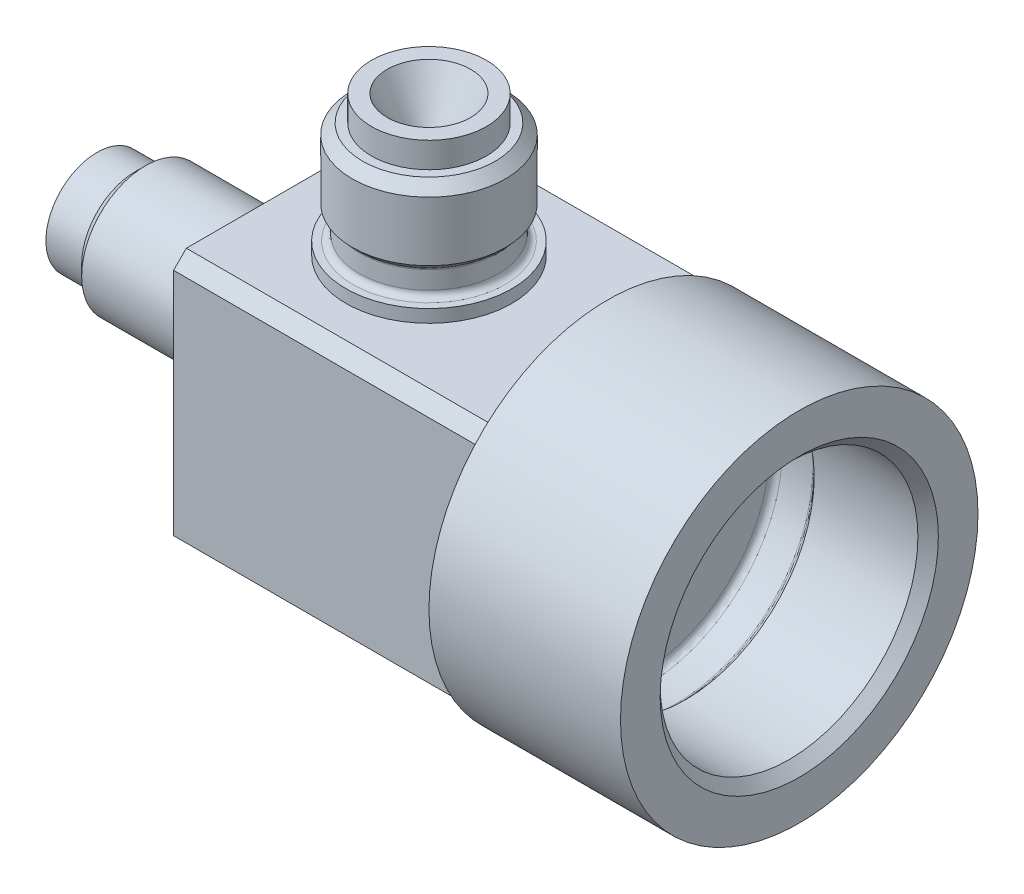
from build123d import *

# Parameters (mm, degrees)
EXTRUDE_2_DEPTH          = 48
CUT_EXTRUDE_1_REACH      = 131.819
CUT_EXTRUDE_1_END_RADIUS = 9
SKETCH_5_R               = 2.5
CHAMFER_1_SIZE           = 1.6
CHAMFER_2_SIZE           = 1.6
FILLET_1_R               = 1
FILLET_2_R               = 0.5
CHAMFER_3_SIZE           = 2
CHAMFER_4_SIZE           = 1.6


with BuildPart() as part:
    # Эскиз1 → Повернуть1 (revolve)
    with BuildSketch(Plane.XY, mode=Mode.PRIVATE) as revolve_1_sk:
        Polygon((0, 20.188), (0, 28), (-30, 28), (-30, 20), (-78, 20), (-78, 11), (-81, 11), (-81, 8.9), (-85, 8.9), (-86.1, 10), (-104, 10), (-104, 8), (-110, 8), (-110, 6.541451884), (-103, 2.5), (-63, 2.5), (-63, 5), (-66, 5), (-66, 9), (-49, 9), (-49, 12.5), (-25, 12.5), (-25, 21.35), (-19, 21.35), (-17.838, 20.188), align=None)
    revolve(revolve_1_sk.sketch.rotate(Axis((0, 0, 0), (-1, 0, 0)), 90), axis=Axis((0, 0, 0), (-1, 0, 0)))

    # Эскиз2 → Бобышка-Вытянуть2 (add)
    with BuildSketch(Plane.ZY.offset(78)):
        with BuildLine():
            ThreePointArc((9.9e-08, 20), (14.142135659, 14.142135589), (20, 0))
            Line((20, 0), (20, 20))
            Line((20, 20), (9.9e-08, 20))
        make_face()
        with BuildLine():
            Line((-20, 20), (-20, 9.9e-08))
            ThreePointArc((-20, 9.9e-08), (-14.142135554, 14.142135694), (9.9e-08, 20))
            Line((9.9e-08, 20), (-20, 20))
        make_face()
        with BuildLine():
            Line((-20, 9.9e-08), (-20, -20))
            Line((-20, -20), (-9.9e-08, -20))
            ThreePointArc((-9.9e-08, -20), (-14.142135694, -14.142135554), (-20, 9.9e-08))
        make_face()
        with BuildLine():
            ThreePointArc((20, 0), (14.142135589, -14.142135659), (-9.9e-08, -20))
            Line((-9.9e-08, -20), (20, -20))
            Line((20, -20), (20, 0))
        make_face()
    extrude(amount=-EXTRUDE_2_DEPTH)

    # Эскиз4 → Повернуть2 (revolve)
    with BuildSketch(Plane.XY, mode=Mode.PRIVATE) as revolve_2_sk:
        Polygon((-45, 20), (-45, 22), (-47.1, 22), (-47.1, 26), (-46, 27.1), (-46, 38), (-49, 38), (-49, 42), (-51.458548116, 42), (-55.5, 35), (-58, 35), (-58, 20), align=None)
    revolve(revolve_2_sk.sketch.rotate(Axis((-58, 0, 0), (0, 1, 0)), 90), axis=Axis((-58, 0, 0), (0, 1, 0)))

    # Вырез-Вытянуть1: up to this cylinder (the profile starts outside it)
    cut_extrude_1_end = Plane(origin=(-58, 0, 0), z_dir=(1, 0, 0)) * Cylinder(CUT_EXTRUDE_1_END_RADIUS, 282.638, mode=Mode.PRIVATE)
    # Эскиз5 → Вырез-Вытянуть1 (cut, up to the surface)
    with BuildSketch(Plane(origin=(0, 35, 0), x_dir=(1, 0, 0), z_dir=(0, 1, 0)), mode=Mode.PRIVATE) as cut_extrude_1_sk1:
        with Locations(Location((-58, 0, 0), (0, 0, 270))):
            Circle(SKETCH_5_R)
    cut_extrude_1_tool1 = extrude(cut_extrude_1_sk1.sketch, amount=-CUT_EXTRUDE_1_REACH, mode=Mode.PRIVATE) - cut_extrude_1_end
    add(cut_extrude_1_tool1.solids().sort_by_distance((-58, 35, 0))[0], mode=Mode.SUBTRACT)

    # Фаска1
    chamfer_1_edges = [part.edges().sort_by_distance(p)[0] for p in [
        (0, 0, 20.188),
    ]]
    chamfer(chamfer_1_edges, length=CHAMFER_1_SIZE)

    # Фаска2
    chamfer_2_edges = [part.edges().sort_by_distance(p)[0] for p in [
        (-58, 38, 12),
    ]]
    chamfer(chamfer_2_edges, length=CHAMFER_2_SIZE)

    # Скругление1
    fillet_1_edges = [part.edges().sort_by_distance(p)[0] for p in [
        (-25, 0, 21.35),
        (-81, 0, 8.9),
        (-58, 22, 10.9),
    ]]
    fillet(fillet_1_edges, radius=FILLET_1_R)

    # Скругление2
    fillet_2_edges = [part.edges().sort_by_distance(p)[0] for p in [
        (-19, 0, 21.35),
        (-85, 0, 8.9),
        (-58, 26, 10.9),
    ]]
    fillet(fillet_2_edges, radius=FILLET_2_R)

    # Фаска3
    # the kernel refuses this chamfer: 2 mm, written as the material it takes off along each edge
    with BuildSketch(Plane(origin=(-83.143365976, 20, 20), x_dir=(0, 0.027495876610585647, -0.9996219169112968), z_dir=(1, 0, 0)), Plane(origin=(-83.143365976, -20, 20), x_dir=(0, 0.9996219169112968, 0.027495876610585647), z_dir=(1, 0, 0))) as chamfer_3_piece_1:
        Polygon((CHAMFER_3_SIZE * 0.999621916911, -CHAMFER_3_SIZE * 0.0274958766106), (-CHAMFER_3_SIZE * 0.0274958766106, -CHAMFER_3_SIZE * 0.999621916911), (0, 0), align=None)
    extrude(amount=53.143365976, mode=Mode.SUBTRACT)
    with BuildSketch(Plane(origin=(-83.143365976, 20, -20), x_dir=(0, 0.027495876610585647, 0.9996219169112968), z_dir=(1, 0, 0)), Plane(origin=(-83.143365976, -20, -20), x_dir=(0, 0.9996219169112968, -0.027495876610585647), z_dir=(1, 0, 0))) as chamfer_3_piece_2:
        Polygon((CHAMFER_3_SIZE * 0.999621916911, CHAMFER_3_SIZE * 0.0274958766106), (-CHAMFER_3_SIZE * 0.0274958766106, CHAMFER_3_SIZE * 0.999621916911), (0, 0), align=None)
    extrude(amount=53.143365976, mode=Mode.SUBTRACT)

    # Фаска4
    chamfer_4_edges = [part.edges().sort_by_distance(p)[0] for p in [
        (-104, 0, 10),
    ]]
    chamfer(chamfer_4_edges, length=CHAMFER_4_SIZE)


solid = part.part
